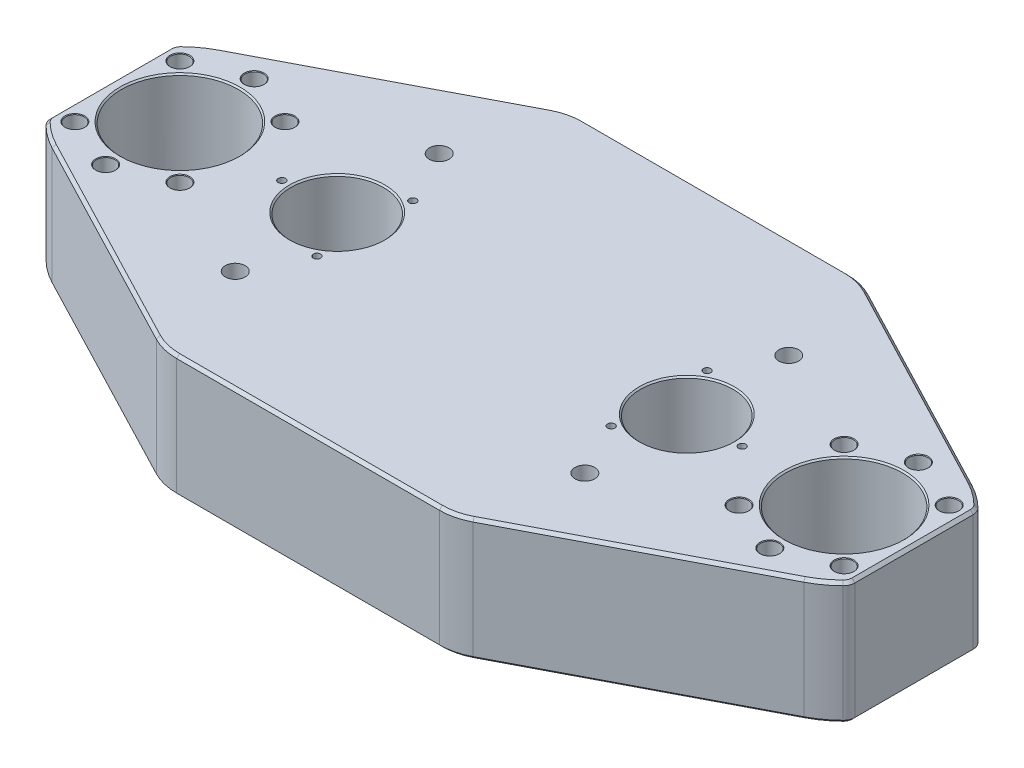
from build123d import *

# Parameters (mm, degrees)
SKETCH1_R                      = 20.1
SKETCH1_R_2                    = 15.875
BOSS_EXTRUDE1_DEPTH            = 21
M6_CLEARANCE_HOLE1_D           = 6.4
CHAMFER2_SIZE                  = 0.5
CHAMFER5_SIZE                  = 1
CHAMFER6_SIZE                  = 0.5
M3X0_5_TAPPED_HOLE1_AT_2_COUNT = 2
M3X0_5_TAPPED_HOLE1_AT_2_PITCH = 32.908965344
M3X0_5_TAPPED_HOLE1_AT_3_COUNT = 2
M3X0_5_TAPPED_HOLE1_AT_3_PITCH = 32.908965344
CHAMFER9_SIZE                  = 0.2
M8X1_25_TAPPED_HOLE1_D         = 6.8
MIRROR9_COPY_1_D               = 6.8
MIRROR9_COPY_2_D               = 6.8


with BuildPart() as part:
    # Sketch1 → Boss-Extrude1 (new, symmetric)
    with BuildSketch(Plane(origin=(0, 0, 0), x_dir=(1, 0, 0), z_dir=(0, 1, 0))):
        with BuildLine():
            Line((-129.019397533, 28.821306316), (-54.344115966, 67.736188502))
            ThreePointArc((-54.344115966, 67.736188502), (-49.859362606, 69.425804617), (-45.101409792, 70))
            Line((-45.101409792, 70), (45.101409792, 70))
            ThreePointArc((45.101409792, 70), (49.859362606, 69.425804617), (54.344115966, 67.736188502))
            Line((54.344115966, 67.736188502), (129.019397533, 28.821306316))
            ThreePointArc((129.019397533, 28.821306316), (133.124332583, 26.277555123), (136.807017544, 23.153616364))
            ThreePointArc((136.807017544, 23.153616364), (137.689720191, 21.848597396), (138, 20.303940504))
            Line((138, 20.303940504), (138, -20.303940504))
            ThreePointArc((138, -20.303940504), (137.689720191, -21.848597396), (136.807017544, -23.153616364))
            ThreePointArc((136.807017544, -23.153616364), (133.124332583, -26.277555123), (129.019397533, -28.821306316))
            Line((129.019397533, -28.821306316), (54.344115966, -67.736188502))
            ThreePointArc((54.344115966, -67.736188502), (49.859362606, -69.425804617), (45.101409792, -70))
            Line((45.101409792, -70), (-45.101409792, -70))
            ThreePointArc((-45.101409792, -70), (-49.859362606, -69.425804617), (-54.344115966, -67.736188502))
            Line((-54.344115966, -67.736188502), (-129.019397533, -28.821306316))
            ThreePointArc((-129.019397533, -28.821306316), (-133.124332583, -26.277555123), (-136.807017544, -23.153616364))
            ThreePointArc((-136.807017544, -23.153616364), (-137.689720191, -21.848597396), (-138, -20.303940504))
            Line((-138, -20.303940504), (-138, 20.303940504))
            ThreePointArc((-138, 20.303940504), (-137.689720191, 21.848597396), (-136.807017544, 23.153616364))
            ThreePointArc((-136.807017544, 23.153616364), (-133.124332583, 26.277555123), (-129.019397533, 28.821306316))
        make_face()
        with Locations((-114, 0)):
            Circle(SKETCH1_R, mode=Mode.SUBTRACT)
        with Locations((114, 0)):
            Circle(SKETCH1_R, mode=Mode.SUBTRACT)
        with Locations((-60, 0)):
            Circle(SKETCH1_R_2, mode=Mode.SUBTRACT)
        with Locations((60, 0)):
            Circle(SKETCH1_R_2, mode=Mode.SUBTRACT)
    extrude(amount=BOSS_EXTRUDE1_DEPTH, both=True)

    # M6 Clearance Hole1 (through all)
    with Locations(Plane(origin=(0, -21, 0), x_dir=(-1, 0, 0), z_dir=(0, -1, 0))):
        with Locations((-95.96877708, -18.03122292), (-114, -25.5), (-132.03122292, -18.03122292), (-132.03122292, 18.03122292), (-114, 25.5), (-95.96877708, 18.03122292)):
            m6_clearance_hole1 = Hole(M6_CLEARANCE_HOLE1_D / 2)

    # Mirror5: M6 Clearance Hole1 across plane
    add(m6_clearance_hole1.mirror(Plane(origin=(0, 0, 0), x_dir=(0, 0, 1), z_dir=(1, 0, 0))), mode=Mode.SUBTRACT)

    # Chamfer2
    chamfer2_edges = [part.edges().sort_by_distance(p)[0] for p in [
        (93.9, 21, 0),
        (93.9, -21, 0),
        (-134.1, -21, 0),
        (-134.1, 21, 0),
    ]]
    chamfer(chamfer2_edges, length=CHAMFER2_SIZE)

    # Chamfer5
    chamfer5_edges = [part.edges().sort_by_distance(p)[0] for p in [
        (91.68175675, -21, -48.278747409),
        (-91.68175675, -21, -48.278747409),
        (49.859362606, -21, -69.425804617),
        (-49.859362606, -21, -69.425804617),
        (0, -21, -70),
        (-133.124332583, -21, -26.277555123),
        (133.124332583, -21, 26.277555123),
        (-91.68175675, -21, 48.278747409),
        (91.68175675, -21, 48.278747409),
        (-49.859362606, -21, 69.425804617),
        (49.859362606, -21, 69.425804617),
        (0, -21, 70),
        (91.68175675, 21, -48.278747409),
        (-91.68175675, 21, -48.278747409),
        (49.859362606, 21, -69.425804617),
        (-49.859362606, 21, -69.425804617),
        (0, 21, -70),
        (-133.124332583, 21, -26.277555123),
        (133.124332583, 21, 26.277555123),
        (-91.68175675, 21, 48.278747409),
        (91.68175675, 21, 48.278747409),
        (-49.859362606, 21, 69.425804617),
        (49.859362606, 21, 69.425804617),
        (0, 21, 70),
        (133.124332583, -21, -26.277555123),
        (-133.124332583, -21, 26.277555123),
        (133.124332583, 21, -26.277555123),
        (-133.124332583, 21, 26.277555123),
        (-137.689720191, -21, -21.848597396),
        (137.689720191, -21, -21.848597396),
        (-138, -21, 0),
        (138, -21, 0),
        (-137.689720191, -21, 21.848597396),
        (137.689720191, -21, 21.848597396),
        (-137.689720191, 21, -21.848597396),
        (137.689720191, 21, -21.848597396),
        (-138, 21, 0),
        (138, 21, 0),
        (-137.689720191, 21, 21.848597396),
        (137.689720191, 21, 21.848597396),
    ]]
    chamfer(chamfer5_edges, length=CHAMFER5_SIZE)

    # Chamfer6
    chamfer6_edges = [part.edges().sort_by_distance(p)[0] for p in [
        (44.125, -21, 0),
        (44.125, 21, 0),
        (-75.875, -21, 0),
        (-75.875, 21, 0),
    ]]
    chamfer(chamfer6_edges, length=CHAMFER6_SIZE)

    # Sketch13 → M3x0.5 Tapped Hole1 (revolve, cut)
    with BuildSketch(Plane(origin=(79, 21, 0), x_dir=(0, 0, 1), z_dir=(1, 0, 0))):
        Polygon((0, 0), (0, 8.251075774), (1.25, 7.5), (1.25, 0), align=None)
    m3x0_5_tapped_hole1 = revolve(axis=Axis((79, 27.35, 0), (0, -1, 0)), mode=Mode.SUBTRACT)

    # M3x0.5 Tapped Hole1 at 2: M3x0.5 Tapped Hole1 ×2
    with Locations(*[Vector(-0.8660254037844387, 0, 0.5000000000000001) * (i * M3X0_5_TAPPED_HOLE1_AT_2_PITCH) for i in range(1, M3X0_5_TAPPED_HOLE1_AT_2_COUNT)]):
        add(m3x0_5_tapped_hole1, mode=Mode.SUBTRACT)

    # M3x0.5 Tapped Hole1 at 3: M3x0.5 Tapped Hole1 ×2
    with Locations(*[Vector(-0.8660254037844387, 0, -0.5000000000000001) * (i * M3X0_5_TAPPED_HOLE1_AT_3_PITCH) for i in range(1, M3X0_5_TAPPED_HOLE1_AT_3_COUNT)]):
        add(m3x0_5_tapped_hole1, mode=Mode.SUBTRACT)

    # Mirror6: M3x0.5 Tapped Hole1 across plane
    add(m3x0_5_tapped_hole1.mirror(Plane(origin=(0, 0, 0), x_dir=(0, 0, 1), z_dir=(1, 0, 0))), mode=Mode.SUBTRACT)

    # Mirror6 copy 1 sketch → Mirror6 copy 1 (revolve, cut)
    with BuildSketch(Plane(origin=(-50.5, 21, 16.454482672), x_dir=(0, 0, 1), z_dir=(-1, 0, 0))):
        Polygon((0, 0), (0, -8.251075774), (1.25, -7.5), (1.25, 0), align=None)
    revolve(axis=Axis((-50.5, 27.35, 16.454482672), (0, 1, 0)), mode=Mode.SUBTRACT)

    # Mirror6 copy 2 sketch → Mirror6 copy 2 (revolve, cut)
    with BuildSketch(Plane(origin=(-50.5, 21, -16.454482672), x_dir=(0, 0, 1), z_dir=(-1, 0, 0))):
        Polygon((0, 0), (0, -8.251075774), (1.25, -7.5), (1.25, 0), align=None)
    revolve(axis=Axis((-50.5, 27.35, -16.454482672), (0, 1, 0)), mode=Mode.SUBTRACT)

    # Mirror7 copy 1 sketch → Mirror7 copy 1 (revolve, cut)
    with BuildSketch(Plane(origin=(-79, -21, 0), x_dir=(0, 0, 1), z_dir=(-1, 0, 0))):
        Polygon((0, 0), (0, 8.251075774), (1.25, 7.5), (1.25, 0), align=None)
    revolve(axis=Axis((-79, -27.35, 0), (0, 1, 0)), mode=Mode.SUBTRACT)

    # Mirror7 copy 2 sketch → Mirror7 copy 2 (revolve, cut)
    with BuildSketch(Plane(origin=(-50.5, -21, 16.454482672), x_dir=(0, 0, 1), z_dir=(-1, 0, 0))):
        Polygon((0, 0), (0, 8.251075774), (1.25, 7.5), (1.25, 0), align=None)
    revolve(axis=Axis((-50.5, -27.35, 16.454482672), (0, 1, 0)), mode=Mode.SUBTRACT)

    # Mirror7 copy 3 sketch → Mirror7 copy 3 (revolve, cut)
    with BuildSketch(Plane(origin=(-50.5, -21, -16.454482672), x_dir=(0, 0, 1), z_dir=(-1, 0, 0))):
        Polygon((0, 0), (0, 8.251075774), (1.25, 7.5), (1.25, 0), align=None)
    revolve(axis=Axis((-50.5, -27.35, -16.454482672), (0, 1, 0)), mode=Mode.SUBTRACT)

    # Mirror7 copy 4 sketch → Mirror7 copy 4 (revolve, cut)
    with BuildSketch(Plane(origin=(79, -21, 0), x_dir=(0, 0, 1), z_dir=(1, 0, 0))):
        Polygon((0, 0), (0, -8.251075774), (1.25, -7.5), (1.25, 0), align=None)
    revolve(axis=Axis((79, -27.35, 0), (0, -1, 0)), mode=Mode.SUBTRACT)

    # Mirror7 copy 5 sketch → Mirror7 copy 5 (revolve, cut)
    with BuildSketch(Plane(origin=(50.5, -21, 16.454482672), x_dir=(0, 0, 1), z_dir=(1, 0, 0))):
        Polygon((0, 0), (0, -8.251075774), (1.25, -7.5), (1.25, 0), align=None)
    revolve(axis=Axis((50.5, -27.35, 16.454482672), (0, -1, 0)), mode=Mode.SUBTRACT)

    # Mirror7 copy 6 sketch → Mirror7 copy 6 (revolve, cut)
    with BuildSketch(Plane(origin=(50.5, -21, -16.454482672), x_dir=(0, 0, 1), z_dir=(1, 0, 0))):
        Polygon((0, 0), (0, -8.251075774), (1.25, -7.5), (1.25, 0), align=None)
    revolve(axis=Axis((50.5, -27.35, -16.454482672), (0, -1, 0)), mode=Mode.SUBTRACT)

    # Chamfer9
    chamfer9_edges = [part.edges().sort_by_distance(p)[0] for p in [
        (-128.83122292, -21, -18.03122292),
        (-128.83122292, 21, -18.03122292),
        (-110.8, -21, -25.5),
        (-110.8, 21, -25.5),
        (-92.76877708, -21, -18.03122292),
        (-92.76877708, 21, -18.03122292),
        (-92.76877708, -21, 18.03122292),
        (-92.76877708, 21, 18.03122292),
        (-110.8, -21, 25.5),
        (-110.8, 21, 25.5),
        (-128.83122292, -21, 18.03122292),
        (-128.83122292, 21, 18.03122292),
        (128.83122292, -21, 18.03122292),
        (128.83122292, 21, 18.03122292),
        (110.8, -21, 25.5),
        (110.8, 21, 25.5),
        (92.76877708, -21, 18.03122292),
        (92.76877708, 21, 18.03122292),
        (92.76877708, -21, -18.03122292),
        (92.76877708, 21, -18.03122292),
        (128.83122292, -21, -18.03122292),
        (128.83122292, 21, -18.03122292),
        (110.8, -21, -25.5),
        (110.8, 21, -25.5),
    ]]
    chamfer(chamfer9_edges, length=CHAMFER9_SIZE)

    # M8x1.25 Tapped Hole1 (through all)
    with Locations(Plane.XZ.offset(21)):
        with Locations((-60, -35)):
            m8x1_25_tapped_hole1 = Hole(M8X1_25_TAPPED_HOLE1_D / 2)

    # Mirror8: M8x1.25 Tapped Hole1 across plane
    add(m8x1_25_tapped_hole1.mirror(Plane.XY), mode=Mode.SUBTRACT)

    # Mirror9 copy 1 (through all)
    with Locations(Plane(origin=(0, -21, 0), x_dir=(-1, 0, 0), z_dir=(0, -1, 0))):
        with Locations((-60, -35)):
            Hole(MIRROR9_COPY_1_D / 2)

    # Mirror9 copy 2 (through all)
    with Locations(Plane(origin=(0, -21, 0), x_dir=(-1, 0, 0), z_dir=(0, -1, 0))):
        with Locations((-60, 35)):
            Hole(MIRROR9_COPY_2_D / 2)


solid = part.part
